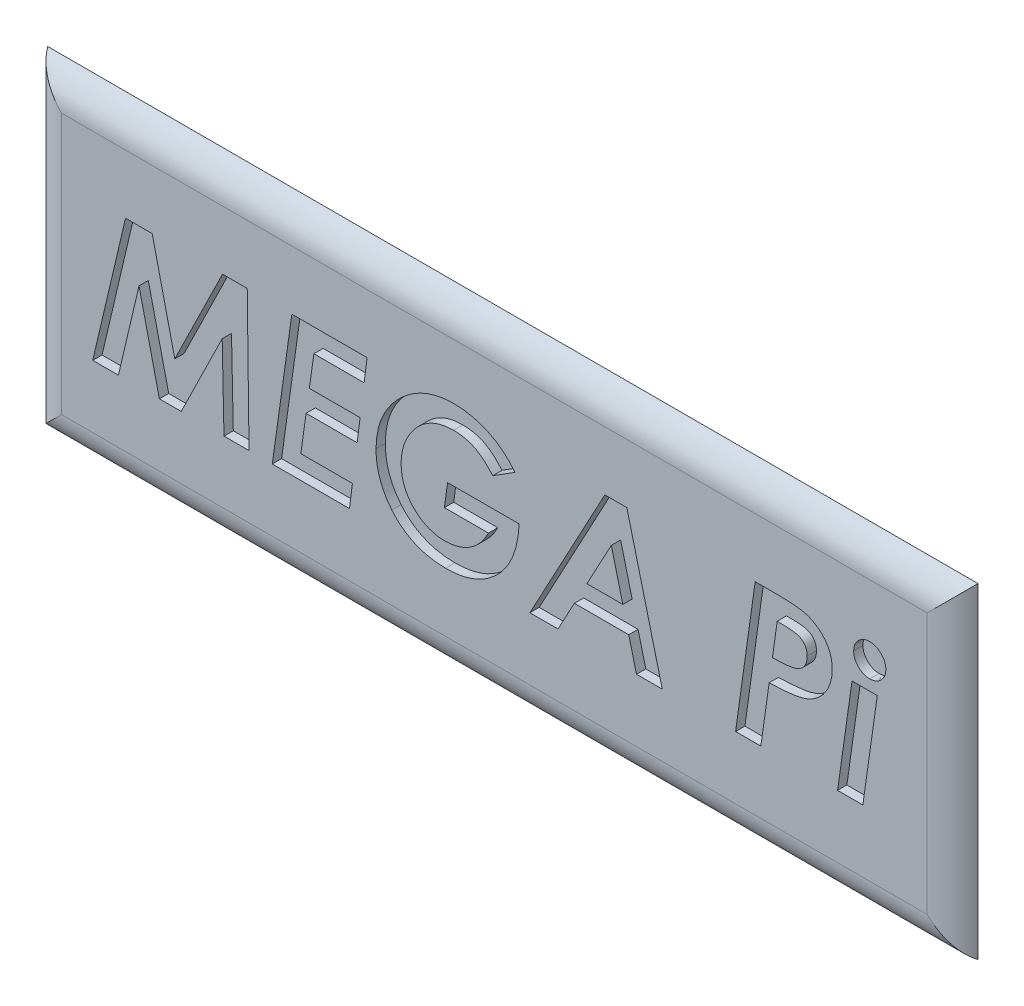
from build123d import *

# Parameters (mm, degrees)
SKETCH1_W           = 100
SKETCH1_H           = 35
BOSS_EXTRUDE1_DEPTH = 2
CUT_EXTRUDE1_DEPTH  = 1
FILLET1_R           = 4


with BuildPart() as part:
    # Sketch1 → Boss-Extrude1 (new body)
    with BuildSketch(Plane.XY):
        with Locations((50, 17.5)):
            Rectangle(SKETCH1_W, SKETCH1_H)
    extrude(amount=BOSS_EXTRUDE1_DEPTH)

    # Sketch2 → Cut-Extrude1 (cut)
    # profile 1 of 7: a face of its own
    with BuildSketch(Plane.XY.offset(2)):
        Polygon((10.358057234, 25.196993375), (13.221638965, 25.196993375), (15.652528388, 14.746272222), (20.784739927, 25.196993375), (23.440989927, 25.196993375), (23.633297619, 10.196993375), (20.940989927, 10.196993375), (20.748682234, 19.169349145), (16.343634158, 10.196993375), (13.99687935, 10.196993375), (11.806374542, 19.620070298), (9.591831273, 10.196993375), (6.833417811, 10.196993375), align=None)
    # profile 2 of 7: a face of its own
    with BuildSketch(Plane.XY.offset(2)):
        Polygon((28.236663004, 25.196993375), (36.325605311, 25.196993375), (36.010100504, 22.696993375), (30.604451465, 22.696993375), (30.117672619, 19.235454914), (35.574403388, 19.235454914), (35.255893773, 16.735454914), (29.766110119, 16.735454914), (29.201206273, 12.696993375), (34.748081273, 12.696993375), (34.432576465, 10.196993375), (26.133297619, 10.196993375), align=None)
    # profile 3 of 7: a face of its own
    with BuildSketch(Plane.XY.offset(2)):
        with BuildLine():
            Line((52.227047619, 22.462618375), (49.838225504, 20.966224145))
            add(Edge.make_bspline(
                [(49.838225504, 20.966224145), (49.66879878, 21.151295608), (49.345132135, 21.504849395), (48.837459668, 21.967115408), (48.337361387, 22.339394782), (47.837091397, 22.622806116), (47.325264622, 22.833273362), (46.787582561, 22.974874978), (46.218448314, 23.064923714), (45.828158205, 23.075961795), (45.628489927, 23.08160876)],
                knots=[0, 0, 0, 0, 1.232977487, 2.355435308, 3.369770187, 4.291348691, 5.174604885, 6.082334442, 7.018942652, 8, 8, 8, 8], degree=3))
            add(Edge.make_bspline(
                [(45.628489927, 23.08160876), (45.411691878, 23.075862299), (44.98560667, 23.064568462), (44.36416055, 22.957695327), (43.772039919, 22.794241235), (43.21177834, 22.55748813), (42.683037267, 22.251139861), (42.185182298, 21.879000848), (41.717865322, 21.440710132), (41.442244791, 21.106671081), (41.30156685, 20.936176068)],
                knots=[0, 0, 0, 0, 1.037106879, 2.038283569, 3.009830787, 3.972569298, 4.94146214, 5.928319872, 6.942605276, 8, 8, 8, 8], degree=3))
            add(Edge.make_bspline(
                [(41.30156685, 20.936176068), (41.195888337, 20.793653507), (40.987125465, 20.512106971), (40.720647915, 20.064041011), (40.491023759, 19.607763583), (40.302784653, 19.1387086), (40.158752396, 18.657794783), (40.057026985, 18.164074404), (39.991271441, 17.659702759), (39.983405595, 17.318589756), (39.979451465, 17.147113568)],
                knots=[0, 0, 0, 0, 1.040960542, 2.056368018, 3.055559505, 4.03710588, 5.019268411, 5.998275661, 6.99374091, 8, 8, 8, 8], degree=3))
            add(Edge.make_bspline(
                [(39.979451465, 17.147113568), (39.983497649, 16.979672787), (39.991474235, 16.649582494), (40.054315144, 16.165019145), (40.165052166, 15.70226238), (40.310255591, 15.257796476), (40.504702073, 14.835649709), (40.740061505, 14.433922434), (41.018261982, 14.05370289), (41.335837869, 13.69816011), (41.683321229, 13.373547847), (42.054306632, 13.089028943), (42.445175226, 12.849546444), (42.856083734, 12.65344381), (43.286776413, 12.499092897), (43.738309278, 12.392050832), (44.208093175, 12.323174822), (44.528485154, 12.316011349), (44.690989927, 12.312377991)],
                knots=[0, 0, 0, 0, 1.066897471, 2.103265977, 3.106535126, 4.095591644, 5.078159493, 6.062322472, 7.058152725, 8.075375883, 9.096057735, 10.084186963, 11.049730852, 12.011871914, 12.980953841, 13.959387168, 14.96498868, 16, 16, 16, 16], degree=3))
            add(Edge.make_bspline(
                [(44.690989927, 12.312377991), (44.813273999, 12.314643602), (45.05537569, 12.319129126), (45.413851001, 12.356240483), (45.764191017, 12.416518581), (46.105929833, 12.499818039), (46.43903129, 12.609346052), (46.764197717, 12.74210949), (47.082325792, 12.897237741), (47.38987128, 13.079299827), (47.687326866, 13.282440866), (47.970487436, 13.511744977), (48.238718279, 13.765790934), (48.494169618, 14.043240783), (48.738509935, 14.34261516), (48.963025602, 14.670168739), (49.17774261, 15.018673399), (49.30680046, 15.264298205), (49.372480311, 15.389301068)],
                knots=[0, 0, 0, 0, 0.990751711, 1.961520103, 2.916931976, 3.869720035, 4.809138875, 5.755683625, 6.713987145, 7.674487982, 8.649319602, 9.630449541, 10.623757948, 11.640402946, 12.684918653, 13.752145235, 14.856026455, 16, 16, 16, 16], degree=3))
            Line((49.372480311, 15.389301068), (44.636903388, 15.389301068))
            Line((44.636903388, 15.389301068), (44.979451465, 17.889301068))
            Line((44.979451465, 17.889301068), (52.671759158, 17.889301068))
            add(Edge.make_bspline(
                [(52.671759158, 17.889301068), (52.652518085, 17.587350904), (52.614891373, 16.996874883), (52.478723369, 16.137071483), (52.277053121, 15.326215706), (52.015641669, 14.561183371), (51.691849784, 13.843401385), (51.300645269, 13.174815266), (50.849693286, 12.552911268), (50.334897261, 11.985842087), (49.771193547, 11.477018686), (49.169120769, 11.027487157), (48.524107539, 10.654608016), (47.844752189, 10.34658742), (47.128380946, 10.104325428), (46.373172455, 9.934483855), (45.58036192, 9.829794385), (45.038874622, 9.818254856), (44.763105311, 9.812377991)],
                knots=[0, 0, 0, 0, 1.148955532, 2.246830018, 3.301660101, 4.319666133, 5.314146826, 6.287838685, 7.257462643, 8.227280698, 9.191724348, 10.138440807, 11.076252923, 12.016254752, 12.968042649, 13.943717582, 14.952773983, 16, 16, 16, 16], degree=3))
            add(Edge.make_bspline(
                [(44.763105311, 9.812377991), (44.611816516, 9.813878167), (44.312935308, 9.816841865), (43.871605617, 9.847287463), (43.442676781, 9.899266487), (43.026418342, 9.967541664), (42.620995071, 10.054807246), (42.228491399, 10.162270418), (41.847996545, 10.291446362), (41.481891107, 10.444495864), (41.122379411, 10.605979214), (40.780619909, 10.798351108), (40.448210405, 11.004837415), (40.130377449, 11.234361986), (39.82233006, 11.480824553), (39.528734683, 11.748168267), (39.247022314, 12.035334042), (39.07091777, 12.239282123), (38.981855311, 12.342426068)],
                knots=[0, 0, 0, 0, 1.111499042, 2.195841241, 3.24834816, 4.285223882, 5.294222847, 6.294054786, 7.273859608, 8.244193736, 9.208986092, 10.167555097, 11.123181443, 12.083077344, 13.046240314, 14.020501641, 14.998895854, 16, 16, 16, 16], degree=3))
            add(Edge.make_bspline(
                [(38.981855311, 12.342426068), (38.846475105, 12.513402112), (38.577683101, 12.852868234), (38.232625422, 13.399844467), (37.938160949, 13.970284195), (37.702349771, 14.56710193), (37.513829203, 15.185691505), (37.382229577, 15.829452367), (37.303056339, 16.497086618), (37.292491986, 16.950583346), (37.287143773, 17.180166452)],
                knots=[0, 0, 0, 0, 0.999328569, 1.984127054, 2.959716786, 3.938705326, 4.922250225, 5.921072174, 6.947541011, 8, 8, 8, 8], degree=3))
            add(Edge.make_bspline(
                [(37.287143773, 17.180166452), (37.294327629, 17.461058689), (37.308503135, 18.015327864), (37.430730797, 18.830233484), (37.620850307, 19.617683534), (37.897481978, 20.373734628), (38.246688172, 21.102677367), (38.678085592, 21.798918695), (39.181225285, 22.470204477), (39.760500822, 23.098259878), (40.38869935, 23.678704966), (41.055747746, 24.18856756), (41.755212837, 24.617733132), (42.481387853, 24.973133015), (43.241204438, 25.243356957), (44.027984308, 25.43892785), (44.845485562, 25.560118355), (45.400707633, 25.574372419), (45.682576465, 25.58160876)],
                knots=[0, 0, 0, 0, 1.022519879, 2.01768214, 2.99445506, 3.968403767, 4.944092992, 5.933246428, 6.946641619, 7.994936793, 9.040543676, 10.058341478, 11.047494914, 12.024771785, 12.997483176, 13.978673844, 14.973836105, 16, 16, 16, 16], degree=3))
            add(Edge.make_bspline(
                [(45.682576465, 25.58160876), (45.894129423, 25.578180339), (46.315383204, 25.571353512), (46.941558821, 25.497407386), (47.560926908, 25.388735813), (48.167488325, 25.227812851), (48.757258608, 25.031550545), (49.322227662, 24.796600636), (49.856945017, 24.523709016), (50.365372529, 24.210150075), (50.852558614, 23.85232482), (51.327712426, 23.443586484), (51.789346547, 22.978030892), (52.079045652, 22.636897287), (52.227047619, 22.462618375)],
                knots=[0, 0, 0, 0, 1.014010841, 2.019144067, 3.019687909, 4.027399918, 5.025300219, 5.998481464, 6.958680332, 7.901091373, 8.859847597, 9.854378501, 10.903841272, 12, 12, 12, 12], degree=3))
        make_face()
    # profile 4 of 7: a face of its own
    with BuildSketch(Plane.XY.offset(2)):
        Polygon((61.88750435, 25.196993375), (64.249283196, 25.196993375), (68.056374542, 10.196993375), (65.28594185, 10.196993375), (64.456614927, 13.466224145), (58.609259158, 13.466224145), (56.854451465, 10.196993375), (53.825605311, 10.196993375), align=None)
        Polygon((63.816590888, 15.966224145), (62.578610119, 20.849036645), (59.955413004, 15.966224145), align=None, mode=Mode.SUBTRACT)
    # profile 5 of 7: a face of its own
    with BuildSketch(Plane.XY.offset(2)):
        with BuildLine():
            Line((78.044355311, 25.196993375), (80.610461081, 25.196993375))
            add(Edge.make_bspline(
                [(80.610461081, 25.196993375), (80.797786353, 25.196230447), (81.158544433, 25.194761169), (81.678539888, 25.1727347), (82.156615398, 25.140778681), (82.591590817, 25.096025276), (82.983379159, 25.041543897), (83.330833142, 24.967579386), (83.638329178, 24.888716614), (83.823214004, 24.81419919), (83.909739927, 24.779325106)],
                knots=[0, 0, 0, 0, 1.344208059, 2.588726621, 3.734329264, 4.782131975, 5.726482068, 6.570895881, 7.331180631, 8, 8, 8, 8], degree=3))
            add(Edge.make_bspline(
                [(83.909739927, 24.779325106), (84.006570663, 24.735633902), (84.197430805, 24.649515488), (84.467097944, 24.49887065), (84.718152102, 24.334999631), (84.952951696, 24.161523006), (85.169778711, 23.974632342), (85.369894612, 23.775831941), (85.549721804, 23.561893395), (85.712819193, 23.336092497), (85.856326828, 23.098389185), (85.983834084, 22.852202849), (86.08817908, 22.595141063), (86.177094222, 22.329749764), (86.242177631, 22.051864491), (86.289368615, 21.76473672), (86.321552708, 21.467749396), (86.324238661, 21.266791554), (86.325605311, 21.164541452)],
                knots=[0, 0, 0, 0, 1.101151138, 2.170445781, 3.198860437, 4.208379212, 5.195204417, 6.164605257, 7.130047863, 8.089887807, 9.049952485, 10.006809717, 10.961522665, 11.923831799, 12.906274987, 13.917075149, 14.940179313, 16, 16, 16, 16], degree=3))
            add(Edge.make_bspline(
                [(86.325605311, 21.164541452), (86.323036287, 21.052290719), (86.317933144, 20.829314462), (86.285115572, 20.499727877), (86.227758617, 20.178240283), (86.145351866, 19.865507962), (86.044621988, 19.55825778), (85.916876699, 19.260864362), (85.770239741, 18.970557836), (85.597893601, 18.693018052), (85.411338664, 18.425558699), (85.202300659, 18.178988273), (84.979537796, 17.95110197), (84.744224815, 17.736911147), (84.48843098, 17.547501569), (84.221120281, 17.370964323), (83.935950532, 17.217756862), (83.631644233, 17.079704832), (83.291801048, 16.96067517), (82.908097595, 16.85721804), (82.472591037, 16.767444632), (81.987012451, 16.694125117), (81.449748182, 16.634057131), (80.862301967, 16.591333266), (80.223194462, 16.556764763), (79.78018054, 16.547806511), (79.549763965, 16.543147222)],
                knots=[0, 0, 0, 0, 0.866399648, 1.721027061, 2.553550129, 3.384204618, 4.21539855, 5.04677222, 5.880012857, 6.723270778, 7.566245156, 8.394738354, 9.214784533, 10.025005932, 10.847562629, 11.668810448, 12.495570546, 13.343317016, 14.245569203, 15.271435576, 16.408570332, 17.675782105, 19.060520395, 20.580184572, 22.221315141, 24, 24, 24, 24], degree=3))
            Line((79.549763965, 16.543147222), (78.657336081, 10.196993375))
            Line((78.657336081, 10.196993375), (75.940989927, 10.196993375))
            Line((75.940989927, 10.196993375), (78.044355311, 25.196993375))
        make_face()
        with BuildLine():
            add(Edge.make_bspline(
                [(79.898321658, 19.043147222), (80.083633605, 19.046298042), (80.436379844, 19.052295712), (80.940753312, 19.074180164), (81.394817393, 19.116531389), (81.799418741, 19.17135505), (82.153765403, 19.243425809), (82.459076406, 19.327230363), (82.712827352, 19.432202573), (82.922915832, 19.55052045), (83.08963302, 19.691402056), (83.237394174, 19.839084414), (83.360945637, 20.005003503), (83.460224615, 20.187667686), (83.539625352, 20.38391801), (83.592703954, 20.597370643), (83.626094368, 20.824947771), (83.63086302, 20.982129874), (83.633297619, 21.062377991)],
                knots=[0, 0, 0, 0, 1.839895187, 3.502289619, 5.0101303, 6.365671836, 7.553232357, 8.598057788, 9.502875839, 10.27370316, 10.980290013, 11.662314044, 12.34441055, 13.025273935, 13.721358838, 14.440015487, 15.203561875, 16, 16, 16, 16], degree=3))
            add(Edge.make_bspline(
                [(83.633297619, 21.062377991), (83.629651674, 21.151722146), (83.622542851, 21.325924379), (83.57290871, 21.576384076), (83.482504139, 21.803520244), (83.363564967, 22.009499666), (83.207254029, 22.189389643), (83.018462601, 22.341655968), (82.795219439, 22.462340007), (82.582866102, 22.536725633), (82.385565998, 22.584205256), (82.200472445, 22.612325519), (81.983166177, 22.639788008), (81.732408915, 22.659182296), (81.450020716, 22.678051293), (81.133382232, 22.68947762), (80.783756228, 22.6945947), (80.539348811, 22.696172295), (80.412143773, 22.696993375)],
                knots=[0, 0, 0, 0, 1.03742853, 2.022766538, 2.947121861, 3.864647693, 4.771646501, 5.697975149, 6.666071958, 7.703435297, 8.301453266, 9.020359131, 9.87578453, 10.844509861, 11.939964187, 13.162010635, 14.522931311, 16, 16, 16, 16], degree=3))
            Line((80.412143773, 22.696993375), (79.898321658, 19.043147222))
        make_face(mode=Mode.SUBTRACT)
    # profile 6 of 7: a face of its own
    with BuildSketch(Plane.XY.offset(2)):
        with BuildLine():
            add(Edge.make_bspline(
                [(90.36406685, 25.773916452), (90.478814639, 25.767225257), (90.704212978, 25.754081786), (91.03107182, 25.659658828), (91.32614381, 25.490770408), (91.591727114, 25.270807486), (91.811690036, 25.005224182), (91.980578456, 24.710152192), (92.075001415, 24.38329335), (92.088144886, 24.15789501), (92.094836081, 24.043147222)],
                knots=[0, 0, 0, 0, 1.014134371, 1.992057583, 2.975098753, 4, 5.024901247, 6.007942417, 6.985865629, 8, 8, 8, 8], degree=3))
            add(Edge.make_bspline(
                [(92.094836081, 24.043147222), (92.088190509, 23.928373505), (92.075136656, 23.702924237), (91.979811274, 23.375587503), (91.812727588, 23.078439158), (91.591469826, 22.812795901), (91.327051427, 22.591904795), (91.03015109, 22.427303506), (90.704330543, 22.332003126), (90.478854299, 22.318998501), (90.36406685, 22.312377991)],
                knots=[0, 0, 0, 0, 1.013694729, 1.991193998, 2.981551723, 4.006008661, 5.030465598, 6.008806002, 6.986305271, 8, 8, 8, 8], degree=3))
            add(Edge.make_bspline(
                [(90.36406685, 22.312377991), (90.249254073, 22.318953219), (90.023728079, 22.331868896), (89.697418286, 22.428069583), (89.398460996, 22.590868154), (89.133969363, 22.813049735), (88.911787782, 23.077541368), (88.748989211, 23.376498657), (88.652788524, 23.702808451), (88.639872847, 23.928334445), (88.633297619, 24.043147222)],
                knots=[0, 0, 0, 0, 1.01324697, 1.990314468, 2.975995575, 4, 5.024004425, 6.009685532, 6.98675303, 8, 8, 8, 8], degree=3))
            add(Edge.make_bspline(
                [(88.633297619, 24.043147222), (88.639918129, 24.157934671), (88.652922754, 24.383410914), (88.748223134, 24.709231462), (88.912824423, 25.006131799), (89.13371553, 25.270550198), (89.399358786, 25.49180796), (89.696507132, 25.658891646), (90.023843865, 25.754217028), (90.249293133, 25.767270881), (90.36406685, 25.773916452)],
                knots=[0, 0, 0, 0, 1.013694729, 1.991193998, 2.969534402, 3.993991339, 5.018448277, 6.008806002, 6.986305271, 8, 8, 8, 8], degree=3))
        make_face()
    # profile 7 of 7: a face of its own
    with BuildSketch(Plane.XY.offset(2)):
        Polygon((88.459018773, 21.158531837), (91.175364927, 21.158531837), (89.618874542, 10.196993375), (86.902528388, 10.196993375), align=None)
    extrude(amount=-CUT_EXTRUDE1_DEPTH, mode=Mode.SUBTRACT)

    # Fillet1
    # the kernel refuses this fillet: 4 mm, written as the material it takes off along each edge
    with BuildSketch(Plane(origin=(100, -8.660254038, 2), x_dir=(0, 0, -1), z_dir=(0, 1, 0)), Plane(origin=(0, 43.660254038, 2), x_dir=(0, 0, -1), z_dir=(0, -1, 0))) as fillet1_piece_1:
        with BuildLine():
            CenterArc((4, 3.464101615), FILLET1_R, 180, 60)
            Line((0, 3.464101615), (-0.08, 3.464101615))
            Line((-0.08, 3.464101615), (-0.08, 0))
            Line((-0.08, 0), (0, -0.08))
            ThreePointArc((0, -0.08), (1, -0.08), (1.96, -0.069282032))
            Line((1.96, -0.069282032), (2, 0))
        make_face()
    extrude(amount=52.320508076, mode=Mode.SUBTRACT)
    with BuildSketch(Plane(origin=(-8.660254038, 0, 2), x_dir=(0, 0, -1), z_dir=(1, 0, 0))) as fillet1_piece_2:
        with BuildLine():
            CenterArc((4, 3.464101615), FILLET1_R, 180, 60)
            Line((0, 3.464101615), (-0.08, 3.464101615))
            Line((-0.08, 3.464101615), (-0.08, 0))
            Line((-0.08, 0), (0, -0.08))
            ThreePointArc((0, -0.08), (1, -0.08), (1.96, -0.069282032))
            Line((1.96, -0.069282032), (2, 0))
        make_face()
    extrude(amount=117.320508076, mode=Mode.SUBTRACT)
    with BuildSketch(Plane(origin=(108.660254038, 35, 2), x_dir=(0, -1, 0), z_dir=(-1, 0, 0))) as fillet1_piece_3:
        with BuildLine():
            CenterArc((3.464101615, -4), FILLET1_R, 90, 60)
            Line((0, -2), (-0.069282032, -1.96))
            ThreePointArc((-0.069282032, -1.96), (-0.08, -1), (-0.08, 0))
            Line((-0.08, 0), (0, 0.08))
            Line((0, 0.08), (3.464101615, 0.08))
            Line((3.464101615, 0.08), (3.464101615, 0))
        make_face()
    extrude(amount=117.320508076, mode=Mode.SUBTRACT)


solid = part.part
